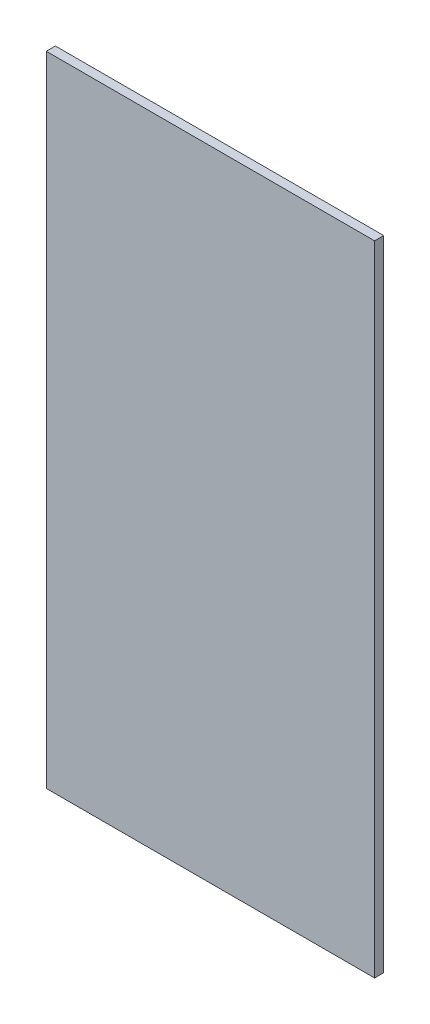
from build123d import *

# Parameters (mm, degrees)
SKETCH1_W           = 228.6
SKETCH1_H           = 444.5
BOSS_EXTRUDE1_DEPTH = 6.35


with BuildPart() as part:
    # Sketch1 → Boss-Extrude1 (new body)
    with BuildSketch(Plane.XY):
        with Locations((-114.3, -222.25)):
            Rectangle(SKETCH1_W, SKETCH1_H)
    extrude(amount=BOSS_EXTRUDE1_DEPTH)


solid = part.part
